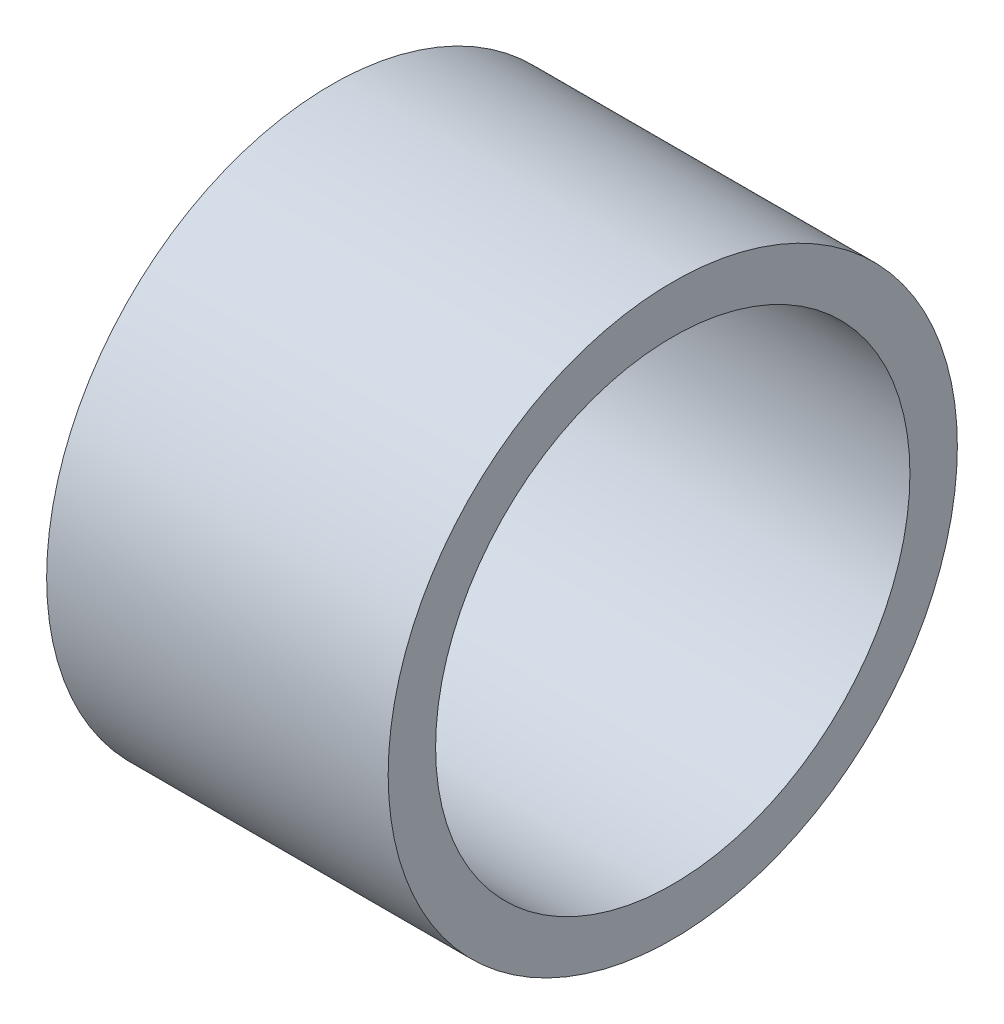
from build123d import *

# Parameters (mm, degrees)
SKETCH2_R           = 9.525
SKETCH2_R_2         = 7.9375
BOSS_EXTRUDE1_DEPTH = 11.43


with BuildPart() as part:
    # Sketch2 → Boss-Extrude1 (new body)
    with BuildSketch(Plane.YZ):
        Circle(SKETCH2_R)
        Circle(SKETCH2_R_2, mode=Mode.SUBTRACT)
    extrude(amount=BOSS_EXTRUDE1_DEPTH)


solid = part.part
